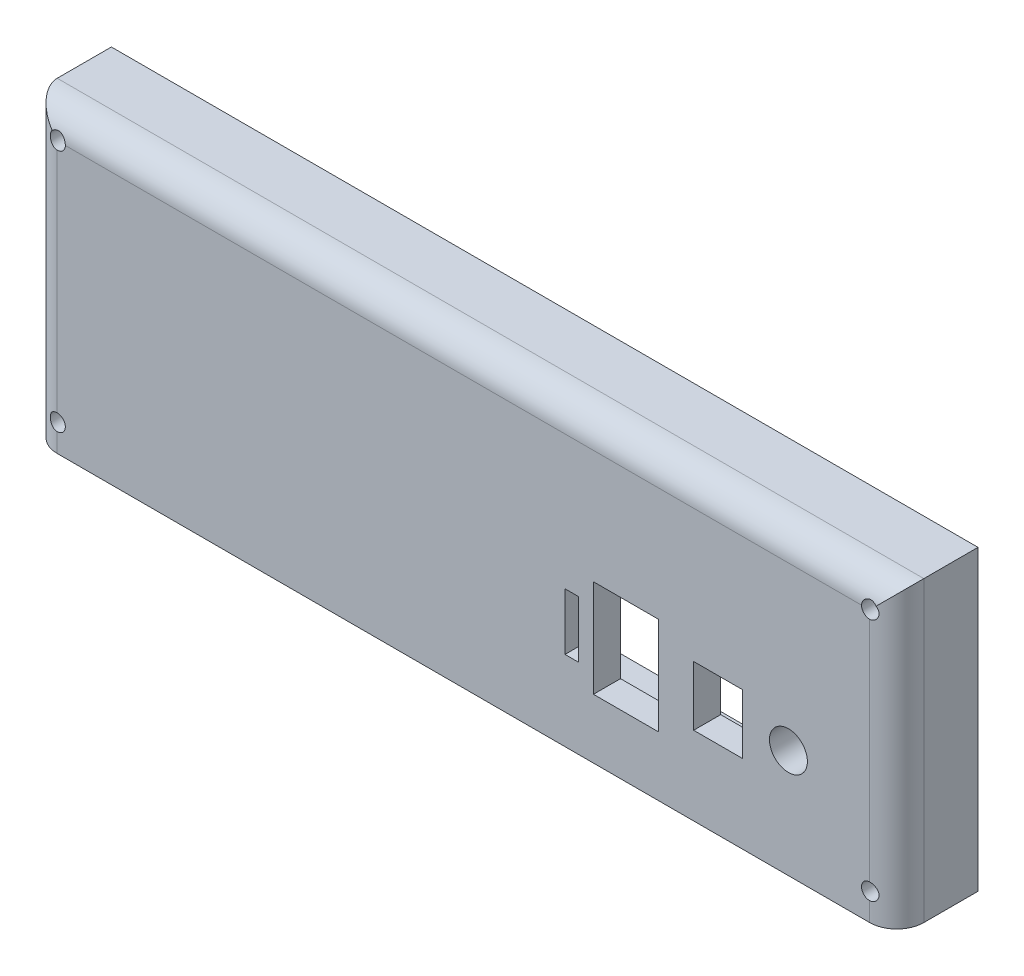
from build123d import *

# Parameters (mm, degrees)
SKETCH_1_W          = 160
SKETCH_1_H          = 55
EXTRUDE_1_DEPTH     = 5
SKETCH_2_R          = 3.5
SKETCH_2_W          = 9
SKETCH_2_H          = 11
SKETCH_2_W_2        = 12
SKETCH_2_H_2        = 18
SKETCH_2_W_3        = 2.5
SKETCH_2_H_3        = 10.5
CUT_EXTRUDE_1_DEPTH = 5
SKETCH_3_R          = 1.5
CUT_EXTRUDE_2_DEPTH = 10
FILLET_1_R          = 5
SKETCH_5_W          = 160
SKETCH_5_H          = 55
EXTRUDE_2_DEPTH     = 10
SKETCH_6_W          = 150
SKETCH_6_H          = 45
CUT_EXTRUDE_3_DEPTH = 10
SKETCH_3_2_R        = 1.5
CUT_EXTRUDE_4_DEPTH = 86.914201512


with BuildPart() as part:
    # Эскиз1 → Бобышка-Вытянуть1 (new body)
    with BuildSketch(Plane.XY):
        Rectangle(SKETCH_1_W, SKETCH_1_H)
    extrude(amount=EXTRUDE_1_DEPTH)

    # Эскиз2 → Вырез-Вытянуть1 (cut)
    with BuildSketch(Plane.XY.offset(5)):
        with Locations((60, -7.5)):
            Circle(SKETCH_2_R)
        with Locations((47, -7.5)):
            Rectangle(SKETCH_2_W, SKETCH_2_H)
        with Locations((30, -7.5)):
            Rectangle(SKETCH_2_W_2, SKETCH_2_H_2)
        with Locations((20, -7.5)):
            Rectangle(SKETCH_2_W_3, SKETCH_2_H_3)
    extrude(amount=-CUT_EXTRUDE_1_DEPTH, mode=Mode.SUBTRACT)

    # Эскиз3 → Вырез-Вытянуть2 (cut)
    with BuildSketch(Plane.XY.offset(5)):
        with Locations((-75, 22.5)):
            Circle(SKETCH_3_R)
        with Locations((-75, -22.5)):
            Circle(SKETCH_3_R)
        with Locations((75, 22.5)):
            Circle(SKETCH_3_R)
        with Locations((75, -22.5)):
            Circle(SKETCH_3_R)
    extrude(amount=-CUT_EXTRUDE_2_DEPTH, mode=Mode.SUBTRACT)

    # Скругление1
    # the kernel refuses this fillet: 5 mm, written as the material it takes off along each edge
    with BuildSketch(Plane(origin=(-80, 40, 5), x_dir=(0, 0, -1), z_dir=(0, -1, 0)), Plane(origin=(80, -40, 5), x_dir=(0, 0, -1), z_dir=(0, 1, 0))) as fillet_1_piece_1:
        with BuildLine():
            CenterArc((FILLET_1_R, FILLET_1_R), FILLET_1_R, 180, 90)
            Line((0, FILLET_1_R), (0, 0))
            Line((0, 0), (FILLET_1_R, 0))
        make_face()
    extrude(amount=80, mode=Mode.SUBTRACT)
    with BuildSketch(Plane(origin=(92.5, 27.5, 5), x_dir=(0, -1, 0), z_dir=(-1, 0, 0))) as fillet_1_piece_2:
        with BuildLine():
            CenterArc((FILLET_1_R, -FILLET_1_R), FILLET_1_R, 90, 90)
            Line((0, -FILLET_1_R), (0, 0))
            Line((0, 0), (FILLET_1_R, 0))
        make_face()
    extrude(amount=185, mode=Mode.SUBTRACT)

    # Эскиз5 → Бобышка-Вытянуть2 (add)
    with BuildSketch(Plane(origin=(0, 0, 0), x_dir=(-1, 0, 0), z_dir=(0, 0, -1))):
        Rectangle(SKETCH_5_W, SKETCH_5_H)
    extrude(amount=EXTRUDE_2_DEPTH)

    # Эскиз6 → Вырез-Вытянуть3 (cut)
    with BuildSketch(Plane(origin=(0, 0, -10), x_dir=(-1, 0, 0), z_dir=(0, 0, -1))):
        Rectangle(SKETCH_6_W, SKETCH_6_H)
    extrude(amount=-CUT_EXTRUDE_3_DEPTH, mode=Mode.SUBTRACT)

    # Эскиз3<2> → Вырез-Вытянуть4 (cut, through all)
    with BuildSketch(Plane.XY.offset(5)):
        with Locations((-75, 22.5)):
            Circle(SKETCH_3_2_R)
        with Locations(Location((-75, -22.5, 0), (0, 0, 90))):
            Circle(SKETCH_3_2_R)
        with Locations(Location((75, 22.5, 0), (0, 0, 270))):
            Circle(SKETCH_3_2_R)
        with Locations(Location((75, -22.5, 0), (0, 0, 90))):
            Circle(SKETCH_3_2_R)
    extrude(amount=-CUT_EXTRUDE_4_DEPTH, mode=Mode.SUBTRACT)


solid = part.part
